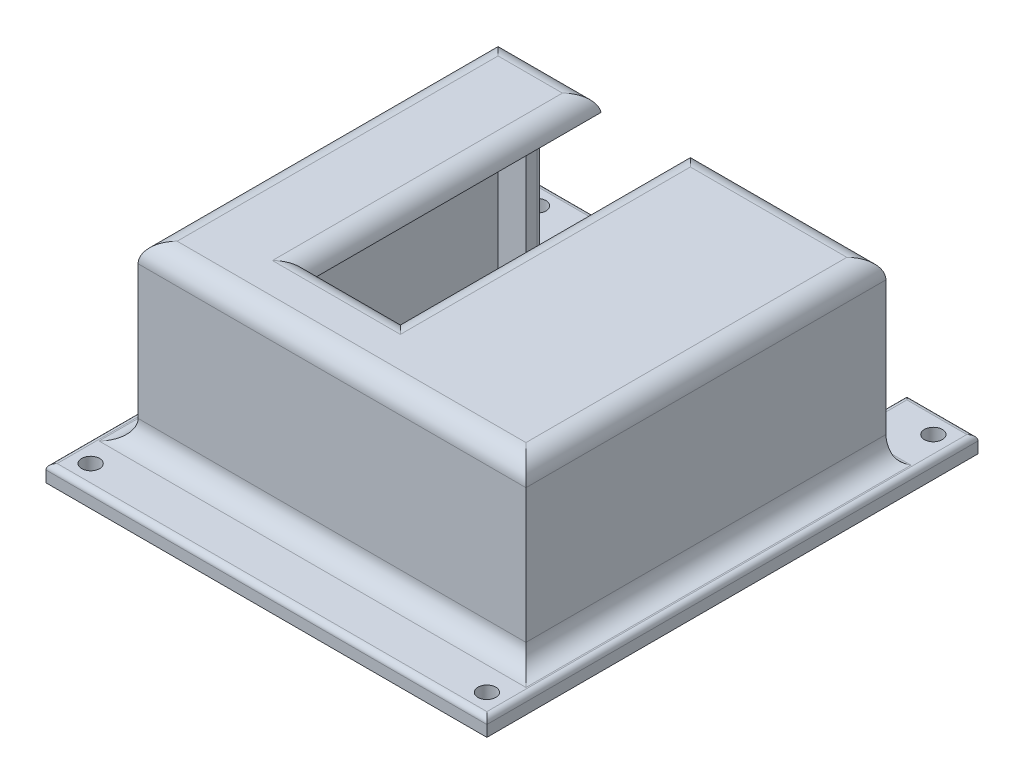
from build123d import *

# Parameters (mm, degrees)
BOSS_EXTRUDE1_DEPTH      = 15.5
BOSS_EXTRUDE1_DEPTH_BACK = 15.5
SKETCH1_W                = 63.5
SKETCH1_H                = 58.5
SHELL1_T                 = 3
SKETCH2_W                = 16
SKETCH2_H                = 52
CUT_EXTRUDE1_DEPTH       = 39.5
SKETCH3_W                = 53.5
SKETCH3_H                = 31
CUT_EXTRUDE2_DEPTH       = 39.5
BOSS_EXTRUDE2_START      = -15.5
SKETCH4_R                = 1.6
BOSS_EXTRUDE2_DEPTH      = 3
FILLET1_R                = 3.5
FILLET2_R                = 1


with BuildPart() as part:
    # Sketch1 → Boss-Extrude1 (new, two sides: drawn at the far end of the back side and taken through both)
    with BuildSketch(Plane(origin=(0, 0, 0), x_dir=(1, 0, 0), z_dir=(0, 1, 0)).offset(-BOSS_EXTRUDE1_DEPTH_BACK)):
        Rectangle(SKETCH1_W, SKETCH1_H)
    extrude(amount=BOSS_EXTRUDE1_DEPTH + BOSS_EXTRUDE1_DEPTH_BACK)

    # Shell1
    shell1_openings = [part.faces().sort_by_distance(p)[0] for p in [
        (0, -15.5, 0),
    ]]
    offset(amount=SHELL1_T, openings=shell1_openings, kind=Kind.INTERSECTION)

    # Sketch2 → Cut-Extrude1 (cut)
    with BuildSketch(Plane(origin=(0, 18.5, 0), x_dir=(1, 0, 0), z_dir=(0, 1, 0))):
        with Locations((-8.25, 6.25)):
            Rectangle(SKETCH2_W, SKETCH2_H)
    extrude(amount=-CUT_EXTRUDE1_DEPTH, mode=Mode.SUBTRACT)

    # Sketch3 → Cut-Extrude2 (cut)
    with BuildSketch(Plane(origin=(0, 0, -32.25), x_dir=(-1, 0, 0), z_dir=(0, 0, -1))):
        Rectangle(SKETCH3_W, SKETCH3_H)
    extrude(amount=-CUT_EXTRUDE2_DEPTH, mode=Mode.SUBTRACT)

    # Sketch4 → Boss-Extrude2 (add)
    with BuildSketch(Plane(origin=(0, 0, 0), x_dir=(1, 0, 0), z_dir=(0, 1, 0)).offset(BOSS_EXTRUDE2_START)):
        Polygon((-26.75, 32.25), (-26.75, 44), (-39.5, 44), (-39.5, -44), (39.5, -44), (39.5, 44), (26.75, 44), (26.75, 32.25), (34.75, 32.25), (34.75, -32.25), (-34.75, -32.25), (-34.75, 32.25), align=None)
        with Locations(Location((-35.5, 40, 0), (0, 0, 90))):
            Circle(SKETCH4_R, mode=Mode.SUBTRACT)
        with Locations(Location((-35.5, -40, 0), (0, 0, 90))):
            Circle(SKETCH4_R, mode=Mode.SUBTRACT)
        with Locations(Location((35.5, -40, 0), (0, 0, 90))):
            Circle(SKETCH4_R, mode=Mode.SUBTRACT)
        with Locations(Location((35.5, 40, 0), (0, 0, 90))):
            Circle(SKETCH4_R, mode=Mode.SUBTRACT)
    extrude(amount=BOSS_EXTRUDE2_DEPTH)

    # Fillet1
    # the kernel refuses this fillet: 3.5 mm, written as the material it adds along each edge
    with BuildSketch(Plane(origin=(34.75, -12.5, -32.25), x_dir=(1, 0, 0), z_dir=(0, 0, 1)), Plane(origin=(-34.75, -12.5, 32.25), x_dir=(-1, 0, 0), z_dir=(0, 0, -1))) as fillet1_piece_1:
        with BuildLine():
            CenterArc((FILLET1_R, FILLET1_R), FILLET1_R, 180, 90)
            Line((0, FILLET1_R), (0, 0))
            Line((0, 0), (FILLET1_R, 0))
        make_face()
    extrude(amount=64.5)
    with BuildSketch(Plane(origin=(34.75, -12.5, 32.25), x_dir=(0, 0, 1), z_dir=(-1, 0, 0))) as fillet1_piece_2:
        with BuildLine():
            CenterArc((FILLET1_R, FILLET1_R), FILLET1_R, 180, 90)
            Line((0, FILLET1_R), (0, 0))
            Line((0, 0), (FILLET1_R, 0))
        make_face()
    extrude(amount=69.5)
    with BuildSketch(Plane(origin=(34.75, -12.5, -32.25), x_dir=(1, 0, 0), z_dir=(0, 0, 1))) as fillet1_piece_3a_section:
        with BuildLine():
            CenterArc((FILLET1_R, FILLET1_R), FILLET1_R, 180, 90)
            Line((0, FILLET1_R), (0, 0))
            Line((0, 0), (FILLET1_R, 0))
        make_face()
    fillet1_piece_3a = extrude(amount=73.25, mode=Mode.PRIVATE)
    fillet1_piece_3a = fillet1_piece_3a - Plane(origin=(35.5, -12.5, 40), x_dir=(0, 0, -1), z_dir=(0, -1, 0)) * Cylinder(1.6, 161, mode=Mode.PRIVATE)
    fillet1_piece_3a = split(fillet1_piece_3a, bisect_by=Plane(origin=(34.75, -12.5, 32.25), z_dir=(0, 0, 1)), keep=Keep.TOP, mode=Mode.PRIVATE)
    with BuildSketch(Plane(origin=(43.5, -12.5, 32.25), x_dir=(0, 0, 1), z_dir=(-1, 0, 0))) as fillet1_piece_3b_section:
        with BuildLine():
            CenterArc((FILLET1_R, FILLET1_R), FILLET1_R, 180, 90)
            Line((0, FILLET1_R), (0, 0))
            Line((0, 0), (FILLET1_R, 0))
        make_face()
    fillet1_piece_3b = extrude(amount=78.25, mode=Mode.PRIVATE)
    fillet1_piece_3b = split(fillet1_piece_3b, bisect_by=Plane(origin=(39.5, -12.5, 32.25), z_dir=(-1, 0, 0)), keep=Keep.TOP, mode=Mode.PRIVATE)
    fillet1_piece_3b = split(fillet1_piece_3b, bisect_by=Plane(origin=(34.75, -12.5, 32.25), z_dir=(1, 0, 0)), keep=Keep.TOP, mode=Mode.PRIVATE)
    fillet1_piece_3 = fillet1_piece_3a & fillet1_piece_3b
    add(fillet1_piece_3)
    with BuildSketch(Plane(origin=(34.75, -12.5, 32.25), x_dir=(0, 0, 1), z_dir=(-1, 0, 0))) as fillet1_piece_4a_section:
        with BuildLine():
            CenterArc((FILLET1_R, FILLET1_R), FILLET1_R, 180, 90)
            Line((0, FILLET1_R), (0, 0))
            Line((0, 0), (FILLET1_R, 0))
        make_face()
    fillet1_piece_4a = extrude(amount=78.25, mode=Mode.PRIVATE)
    fillet1_piece_4a = split(fillet1_piece_4a, bisect_by=Plane(origin=(-39.5, -12.5, 32.25), z_dir=(1, 0, 0)), keep=Keep.TOP, mode=Mode.PRIVATE)
    fillet1_piece_4a = split(fillet1_piece_4a, bisect_by=Plane(origin=(-34.75, -12.5, 32.25), z_dir=(-1, 0, 0)), keep=Keep.TOP, mode=Mode.PRIVATE)
    with BuildSketch(Plane(origin=(-34.75, -12.5, 41), x_dir=(-1, 0, 0), z_dir=(0, 0, -1))) as fillet1_piece_4b_section:
        with BuildLine():
            CenterArc((FILLET1_R, FILLET1_R), FILLET1_R, 180, 90)
            Line((0, FILLET1_R), (0, 0))
            Line((0, 0), (FILLET1_R, 0))
        make_face()
    fillet1_piece_4b = extrude(amount=73.25, mode=Mode.PRIVATE)
    fillet1_piece_4b = fillet1_piece_4b - Plane(origin=(-35.5, -12.5, 40), x_dir=(0, 0, -1), z_dir=(0, -1, 0)) * Cylinder(1.6, 161, mode=Mode.PRIVATE)
    fillet1_piece_4b = split(fillet1_piece_4b, bisect_by=Plane(origin=(-34.75, -12.5, 32.25), z_dir=(0, 0, 1)), keep=Keep.TOP, mode=Mode.PRIVATE)
    fillet1_piece_4 = fillet1_piece_4a & fillet1_piece_4b
    add(fillet1_piece_4)
    # the kernel refuses this fillet: 3.5 mm, written as the material it takes off along each edge
    with BuildSketch(Plane(origin=(-0.25, 18.5, 19.75), x_dir=(0, 0, 1), z_dir=(-1, 0, 0))) as fillet1_2_piece_1:
        with BuildLine():
            CenterArc((3.464101615, -3.5), FILLET1_R, 90, 81.786789298)
            Line((0, -3), (0, 0))
            Line((0, 0), (3.464101615, 0))
        make_face()
    extrude(amount=16, mode=Mode.SUBTRACT)
    with BuildSketch(Plane(origin=(-0.25, 18.5, -40.910254038), x_dir=(1, 0, 0), z_dir=(0, 0, 1)), Plane(origin=(-16.25, 18.5, 19.75), x_dir=(-1, 0, 0), z_dir=(0, 0, -1))) as fillet1_2_piece_2:
        with BuildLine():
            CenterArc((3.464101615, -3.5), FILLET1_R, 90, 81.786789298)
            Line((0, -3), (0, 0))
            Line((0, 0), (3.464101615, 0))
        make_face()
    extrude(amount=60.660254038, mode=Mode.SUBTRACT)
    with BuildSketch(Plane(origin=(-7.5, 18.5, -32.25), x_dir=(0, 0, 1), z_dir=(-1, 0, 0))) as fillet1_2_piece_3:
        with BuildLine():
            CenterArc((FILLET1_R, -FILLET1_R), FILLET1_R, 90, 90)
            Line((0, -FILLET1_R), (0, 0))
            Line((0, 0), (FILLET1_R, 0))
        make_face()
    extrude(amount=36, mode=Mode.SUBTRACT)
    with BuildSketch(Plane(origin=(43.5, 18.5, -32.25), x_dir=(0, 0, 1), z_dir=(-1, 0, 0))) as fillet1_2_piece_4:
        with BuildLine():
            CenterArc((FILLET1_R, -FILLET1_R), FILLET1_R, 90, 90)
            Line((0, -FILLET1_R), (0, 0))
            Line((0, 0), (FILLET1_R, 0))
        make_face()
    extrude(amount=52.5, mode=Mode.SUBTRACT)
    with BuildSketch(Plane(origin=(-34.75, 18.5, 41), x_dir=(0, -1, 0), z_dir=(0, 0, -1))) as fillet1_2_piece_5:
        with BuildLine():
            CenterArc((FILLET1_R, -FILLET1_R), FILLET1_R, 90, 90)
            Line((0, -FILLET1_R), (0, 0))
            Line((0, 0), (FILLET1_R, 0))
        make_face()
    extrude(amount=82, mode=Mode.SUBTRACT)
    with BuildSketch(Plane(origin=(34.75, 18.5, 41), x_dir=(0, -1, 0), z_dir=(0, 0, -1))) as fillet1_2_piece_6:
        with BuildLine():
            CenterArc((FILLET1_R, FILLET1_R), FILLET1_R, 180, 90)
            Line((0, FILLET1_R), (0, 0))
            Line((0, 0), (FILLET1_R, 0))
        make_face()
    extrude(amount=82, mode=Mode.SUBTRACT)
    with BuildSketch(Plane(origin=(-43.5, 18.5, 32.25), x_dir=(0, -1, 0), z_dir=(1, 0, 0))) as fillet1_2_piece_7:
        with BuildLine():
            CenterArc((FILLET1_R, FILLET1_R), FILLET1_R, 180, 90)
            Line((0, FILLET1_R), (0, 0))
            Line((0, 0), (FILLET1_R, 0))
        make_face()
    extrude(amount=87, mode=Mode.SUBTRACT)
    with BuildSketch(Plane(origin=(8.410254038, 18.5, 19.75), x_dir=(0, 0, 1), z_dir=(-1, 0, 0))) as fillet1_2_piece_8a_section:
        with BuildLine():
            CenterArc((3.464101615, -3.5), FILLET1_R, 90, 81.786789298)
            Line((0, -3), (0, 0))
            Line((0, 0), (3.464101615, 0))
        make_face()
    fillet1_2_piece_8a = extrude(amount=24.660254038, mode=Mode.PRIVATE)
    fillet1_2_piece_8a = split(fillet1_2_piece_8a, bisect_by=Plane(origin=(-0.25, 18.5, 19.75), z_dir=(1, 0, 0)), keep=Keep.TOP, mode=Mode.PRIVATE)
    with BuildSketch(Plane(origin=(-0.25, 18.5, -32.25), x_dir=(1, 0, 0), z_dir=(0, 0, 1))) as fillet1_2_piece_8b_section:
        with BuildLine():
            CenterArc((3.464101615, -3.5), FILLET1_R, 90, 81.786789298)
            Line((0, -3), (0, 0))
            Line((0, 0), (3.464101615, 0))
        make_face()
    fillet1_2_piece_8b = extrude(amount=60.660254038, mode=Mode.PRIVATE)
    fillet1_2_piece_8b = split(fillet1_2_piece_8b, bisect_by=Plane(origin=(-0.25, 18.5, 19.75), z_dir=(0, 0, 1)), keep=Keep.TOP, mode=Mode.PRIVATE)
    fillet1_2_piece_8 = fillet1_2_piece_8a & fillet1_2_piece_8b
    add(fillet1_2_piece_8, mode=Mode.SUBTRACT)
    with BuildSketch(Plane(origin=(-16.25, 18.5, 28.410254038), x_dir=(-1, 0, 0), z_dir=(0, 0, -1))) as fillet1_2_piece_9a_section:
        with BuildLine():
            CenterArc((3.464101615, -3.5), FILLET1_R, 90, 81.786789298)
            Line((0, -3), (0, 0))
            Line((0, 0), (3.464101615, 0))
        make_face()
    fillet1_2_piece_9a = extrude(amount=60.660254038, mode=Mode.PRIVATE)
    fillet1_2_piece_9a = split(fillet1_2_piece_9a, bisect_by=Plane(origin=(-16.25, 18.5, 19.75), z_dir=(0, 0, 1)), keep=Keep.TOP, mode=Mode.PRIVATE)
    with BuildSketch(Plane(origin=(-0.25, 18.5, 19.75), x_dir=(0, 0, 1), z_dir=(-1, 0, 0))) as fillet1_2_piece_9b_section:
        with BuildLine():
            CenterArc((3.464101615, -3.5), FILLET1_R, 90, 81.786789298)
            Line((0, -3), (0, 0))
            Line((0, 0), (3.464101615, 0))
        make_face()
    fillet1_2_piece_9b = extrude(amount=24.660254038, mode=Mode.PRIVATE)
    fillet1_2_piece_9b = split(fillet1_2_piece_9b, bisect_by=Plane(origin=(-16.25, 18.5, 19.75), z_dir=(-1, 0, 0)), keep=Keep.TOP, mode=Mode.PRIVATE)
    fillet1_2_piece_9 = fillet1_2_piece_9a & fillet1_2_piece_9b
    add(fillet1_2_piece_9, mode=Mode.SUBTRACT)

    # Fillet2
    fillet2_edges = [part.edges().sort_by_distance(p)[0] for p in [
        (26.75, -12.5, -38.125),
        (32.5, -12.5, -32.25),
        (-32.5, -12.5, -32.25),
        (-26.75, -12.5, -38.125),
        (-33.125, -12.5, -44),
        (-39.5, -12.5, 0),
        (0, -12.5, 44),
        (39.5, -12.5, 0),
        (33.125, -12.5, -44),
        (-26.75, 15.250643519, -32.241013868),
        (26.75, 1.25, -32.25),
        (26.75, 15.250643519, -32.241013868),
        (-26.75, 1.25, -32.25),
    ]]
    fillet(fillet2_edges, radius=FILLET2_R)


solid = part.part
